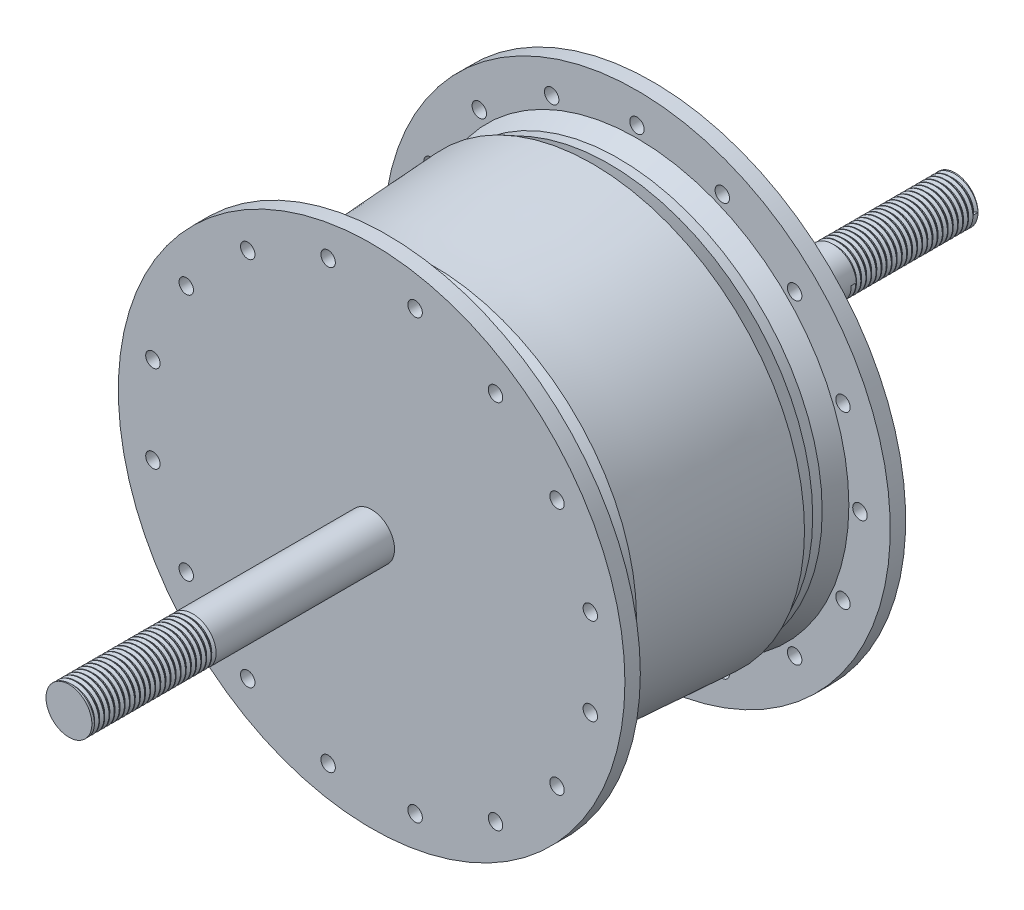
from build123d import *

# Parameters (mm, degrees)
SKETCH2_R                = 52.6
SKETCH2_R_2              = 1.5
BOSS_EXTRUDE1_DEPTH      = 3.2
BOSS_EXTRUDE2_START      = 3.2
SKETCH3_R                = 52.6
SKETCH3_R_2              = 1.5
BOSS_EXTRUDE2_DEPTH      = 3.2
BOSS_EXTRUDE3_DEPTH      = 92
BOSS_EXTRUDE3_DEPTH_BACK = 92
SKETCH4_R                = 4.7625
THREAD1_PITCH            = 1.058333333
THREAD2_PITCH            = 1.058333333


with BuildPart() as part:
    # Sketch1 → Revolve1 (revolve)
    with BuildSketch(Plane(origin=(0, 0, 0), x_dir=(0, 0, -1), z_dir=(1, 0, 0)), mode=Mode.PRIVATE) as revolve1_sk:
        with BuildLine():
            Line((-25.95, 44), (-21.711025697, 41.044756677))
            Line((-21.711025697, 41.044756677), (-20.048841978, 41.044756677))
            Line((-20.048841978, 41.044756677), (-16.447992089, 42.299781694))
            add(Edge.make_bspline(
                [(-16.447992089, 42.299781694), (-8.638947538, 42.299781694), (0, 43.18), (16.74044725, 44)],
                knots=[0, 0, 0, 0, 1, 1, 1, 1], degree=3))
            Line((16.74044725, 44), (20.145782517, 42.299781694))
            Line((20.145782517, 42.299781694), (22.110181459, 42.299781694))
            Line((22.110181459, 42.299781694), (25.95, 44))
            Line((25.95, 44), (25.95, 0))
            Line((25.95, 0), (-25.95, 0))
            Line((-25.95, 0), (-25.95, 44))
        make_face()
    revolve(revolve1_sk.sketch.rotate(Axis((0, 0, 25.95), (0, 0, -1)), 90), axis=Axis((0, 0, 25.95), (0, 0, -1)))

    # Sketch2 → Boss-Extrude1 (add)
    with BuildSketch(Plane.XY.offset(25.95)):
        Circle(SKETCH2_R)
        with Locations((-9.032681909, 45.410358483)):
            Circle(SKETCH2_R_2, mode=Mode.SUBTRACT)
        with Locations((9.032681909, 45.410358483)):
            Circle(SKETCH2_R_2, mode=Mode.SUBTRACT)
        with Locations((25.722901789, 38.49704305)):
            Circle(SKETCH2_R_2, mode=Mode.SUBTRACT)
        with Locations((38.49704305, 25.722901789)):
            Circle(SKETCH2_R_2, mode=Mode.SUBTRACT)
        with Locations((45.410358483, 9.032681909)):
            Circle(SKETCH2_R_2, mode=Mode.SUBTRACT)
        with Locations((45.410358483, -9.032681909)):
            Circle(SKETCH2_R_2, mode=Mode.SUBTRACT)
        with Locations((38.49704305, -25.722901789)):
            Circle(SKETCH2_R_2, mode=Mode.SUBTRACT)
        with Locations((25.722901789, -38.49704305)):
            Circle(SKETCH2_R_2, mode=Mode.SUBTRACT)
        with Locations((9.032681909, -45.410358483)):
            Circle(SKETCH2_R_2, mode=Mode.SUBTRACT)
        with Locations((-9.032681909, -45.410358483)):
            Circle(SKETCH2_R_2, mode=Mode.SUBTRACT)
        with Locations((-25.722901789, -38.49704305)):
            Circle(SKETCH2_R_2, mode=Mode.SUBTRACT)
        with Locations((-38.49704305, -25.722901789)):
            Circle(SKETCH2_R_2, mode=Mode.SUBTRACT)
        with Locations((-45.410358483, -9.032681909)):
            Circle(SKETCH2_R_2, mode=Mode.SUBTRACT)
        with Locations((-45.410358483, 9.032681909)):
            Circle(SKETCH2_R_2, mode=Mode.SUBTRACT)
        with Locations((-38.49704305, 25.722901789)):
            Circle(SKETCH2_R_2, mode=Mode.SUBTRACT)
        with Locations((-25.722901789, 38.49704305)):
            Circle(SKETCH2_R_2, mode=Mode.SUBTRACT)
    extrude(amount=BOSS_EXTRUDE1_DEPTH)

    # Sketch3 → Boss-Extrude2 (add)
    with BuildSketch(Plane(origin=(0, 0, -25.95), x_dir=(-1, 0, 0), z_dir=(0, 0, -1)).offset(BOSS_EXTRUDE2_START)):
        with Locations(Location((0, 0, 0), (0, 0, 180))):
            Circle(SKETCH3_R)
        with Locations((0, 46.3)):
            Circle(SKETCH3_R_2, mode=Mode.SUBTRACT)
        with Locations((17.718242919, 42.775622355)):
            Circle(SKETCH3_R_2, mode=Mode.SUBTRACT)
        with Locations((32.739043969, 32.739043969)):
            Circle(SKETCH3_R_2, mode=Mode.SUBTRACT)
        with Locations((42.775622355, 17.718242919)):
            Circle(SKETCH3_R_2, mode=Mode.SUBTRACT)
        with Locations((46.3, 0)):
            Circle(SKETCH3_R_2, mode=Mode.SUBTRACT)
        with Locations((42.775622355, -17.718242919)):
            Circle(SKETCH3_R_2, mode=Mode.SUBTRACT)
        with Locations((32.739043969, -32.739043969)):
            Circle(SKETCH3_R_2, mode=Mode.SUBTRACT)
        with Locations((17.718242919, -42.775622355)):
            Circle(SKETCH3_R_2, mode=Mode.SUBTRACT)
        with Locations((0, -46.3)):
            Circle(SKETCH3_R_2, mode=Mode.SUBTRACT)
        with Locations((-17.718242918, -42.775622355)):
            Circle(SKETCH3_R_2, mode=Mode.SUBTRACT)
        with Locations((-32.739043969, -32.739043969)):
            Circle(SKETCH3_R_2, mode=Mode.SUBTRACT)
        with Locations((-42.775622355, -17.718242919)):
            Circle(SKETCH3_R_2, mode=Mode.SUBTRACT)
        with Locations((-46.3, 0)):
            Circle(SKETCH3_R_2, mode=Mode.SUBTRACT)
        with Locations((-42.775622355, 17.718242919)):
            Circle(SKETCH3_R_2, mode=Mode.SUBTRACT)
        with Locations((-32.739043969, 32.739043969)):
            Circle(SKETCH3_R_2, mode=Mode.SUBTRACT)
        with Locations((-17.718242919, 42.775622355)):
            Circle(SKETCH3_R_2, mode=Mode.SUBTRACT)
    extrude(amount=-BOSS_EXTRUDE2_DEPTH)

    # Sketch4 → Boss-Extrude3 (add, two sides: drawn at the far end of the back side and taken through both)
    with BuildSketch(Plane.XY.offset(-BOSS_EXTRUDE3_DEPTH_BACK)):
        Circle(SKETCH4_R)
    extrude(amount=BOSS_EXTRUDE3_DEPTH + BOSS_EXTRUDE3_DEPTH_BACK)

    # Thread1: the profile of Thread Profile1 profile screwed along a right-hand helix of 24 turns, 8 arcs to a turn; built about Z, then put on its axis
    thread1_z = Axis((0, 0, 0), (0, 0, 1))
    thread1_corners = [(4.7628, 0, -0.000173205), (4.7628, 0, 0.926214869), (4.189660282, 0, 0.595312499), (4.189660282, 0, 0.330729165)]
    with BuildLine(mode=Mode.PRIVATE) as thread1_profile:
        Line(thread1_corners[0], thread1_corners[1])
        Line(thread1_corners[1], thread1_corners[2])
        Line(thread1_corners[2], thread1_corners[3])
        Line(thread1_corners[3], thread1_corners[0])
    thread1_cap = Face(thread1_profile.wire())
    thread1_turn_angles = [0, 22.5, 45, 67.5, 90, 112.5, 135, 157.5, 180, 202.5, 225, 247.5, 270, 292.5, 315, 337.5, 360]
    thread1_turn_weights = [1, 0.9238795325112867, 1, 0.9238795325112867, 1, 0.9238795325112867, 1, 0.9238795325112867, 1, 0.9238795325112867, 1, 0.9238795325112867, 1, 0.9238795325112867, 1, 0.9238795325112867, 1]
    thread1_turn_rails = [Edge.make_bspline([Vector(p[0], p[1], 0).rotate(thread1_z, thread1_turn_angles[k]) / thread1_turn_weights[k] + Vector(0, 0, p[2] + THREAD1_PITCH * thread1_turn_angles[k] / 360) for k in range(17)], [0, 0, 0, 1, 1, 2, 2, 3, 3, 4, 4, 5, 5, 6, 6, 7, 7, 8, 8, 8], 2, thread1_turn_weights) for p in thread1_corners]
    thread1_turn_sides = [Face.make_surface_from_curves(thread1_turn_rails[p[0]], thread1_turn_rails[p[1]]) for p in [(0, 1), (1, 2), (2, 3), (3, 0)]]
    thread1 = Plane(origin=(0, 0, 92), x_dir=(-1, 0, 0), z_dir=(0, 0, -1)) * Solid(Shell([*[p.moved(Location((0, 0, THREAD1_PITCH * i))) for i in range(24) for p in thread1_turn_sides], thread1_cap, thread1_cap.rotate(thread1_z, 8640).moved(Location((0, 0, THREAD1_PITCH * 8640 / 360)))]))
    add(thread1, mode=Mode.SUBTRACT)

    # Thread2: the profile of Thread Profile2 profile screwed along a right-hand helix of 24 turns, 8 arcs to a turn; built about Z, then put on its axis
    thread2_z = Axis((0, 0, 0), (0, 0, 1))
    thread2_corners = [(4.7628, 0, -0.000173205), (4.7628, 0, 0.926214869), (4.189660282, 0, 0.595312499), (4.189660282, 0, 0.330729165)]
    with BuildLine(mode=Mode.PRIVATE) as thread2_profile:
        Line(thread2_corners[0], thread2_corners[1])
        Line(thread2_corners[1], thread2_corners[2])
        Line(thread2_corners[2], thread2_corners[3])
        Line(thread2_corners[3], thread2_corners[0])
    thread2_cap = Face(thread2_profile.wire())
    thread2_turn_angles = [0, 22.5, 45, 67.5, 90, 112.5, 135, 157.5, 180, 202.5, 225, 247.5, 270, 292.5, 315, 337.5, 360]
    thread2_turn_weights = [1, 0.9238795325112867, 1, 0.9238795325112867, 1, 0.9238795325112867, 1, 0.9238795325112867, 1, 0.9238795325112867, 1, 0.9238795325112867, 1, 0.9238795325112867, 1, 0.9238795325112867, 1]
    thread2_turn_rails = [Edge.make_bspline([Vector(p[0], p[1], 0).rotate(thread2_z, thread2_turn_angles[k]) / thread2_turn_weights[k] + Vector(0, 0, p[2] + THREAD2_PITCH * thread2_turn_angles[k] / 360) for k in range(17)], [0, 0, 0, 1, 1, 2, 2, 3, 3, 4, 4, 5, 5, 6, 6, 7, 7, 8, 8, 8], 2, thread2_turn_weights) for p in thread2_corners]
    thread2_turn_sides = [Face.make_surface_from_curves(thread2_turn_rails[p[0]], thread2_turn_rails[p[1]]) for p in [(0, 1), (1, 2), (2, 3), (3, 0)]]
    thread2 = Plane(origin=(0, 0, -92), x_dir=(1, 0, 0), z_dir=(0, 0, 1)) * Solid(Shell([*[p.moved(Location((0, 0, THREAD2_PITCH * i))) for i in range(24) for p in thread2_turn_sides], thread2_cap, thread2_cap.rotate(thread2_z, 8640).moved(Location((0, 0, THREAD2_PITCH * 8640 / 360)))]))
    add(thread2, mode=Mode.SUBTRACT)


solid = part.part
